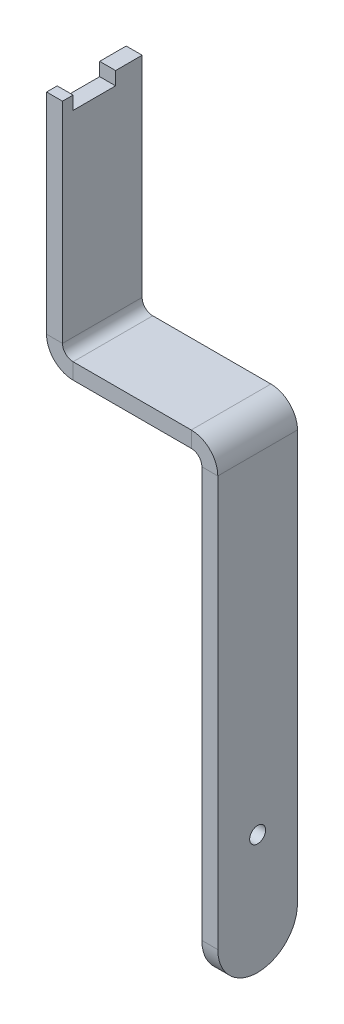
from build123d import *

# Parameters (mm, degrees)
BOSS_EXTRUDE2_DEPTH        = 3
SKETCH5_R                  = 1.5
CUT_EXTRUDE3_DEPTH         = 3
SKETCHED_START             = 72.251106428
SKETCHED_BEND2_OUTLINE_W   = 3
SKETCHED_BEND2_OUTLINE_H   = 15
SKETCHED_BEND2_DEPTH       = 85.748893572
SKETCHED_START_2           = 69.251106428
SKETCHED_BEND2_2_OUTLINE_R = 1.5
SKETCHED_BEND2_2_DEPTH     = 2.5137
SKETCHED_START_3           = 67.251106428
SKETCHED_BEND2_3_OUTLINE_R = 1.5
SKETCHED_BEND2_3_DEPTH     = 5
SKETCHED_START_4           = -107
SKETCHED_BEND2_4_DEPTH     = 17
SKETCHED_START_5           = -105.530592626
SKETCHED_BEND3_DEPTH       = 15
SKETCHED_BEND3_2_DEPTH     = 15
SKETCH26_W                 = 8
SKETCH26_H                 = 2.5
CUT_EXTRUDE8_DEPTH         = 10


with BuildPart() as part:
    # Sketch1 → Boss-Extrude2 (new body)
    with BuildSketch(Plane(origin=(0, 0, 0), x_dir=(1, 0, 0), z_dir=(0, 1, 0))):
        with BuildLine():
            Line((150, 105.530592626), (0, 105.530592626))
            Line((0, 105.530592626), (0, 90.530592626))
            Line((0, 90.530592626), (103.25004789, 90.530592626))
            Line((103.25004789, 90.530592626), (150, 90.530592626))
            ThreePointArc((150, 90.530592626), (157.5, 98.030592626), (150, 105.530592626))
        make_face()
    extrude(amount=BOSS_EXTRUDE2_DEPTH)

    # Sketch5 → Cut-Extrude3 (cut)
    with BuildSketch(Plane(origin=(0, 3, 0), x_dir=(1, 0, 0), z_dir=(0, 1, 0))):
        with Locations(Location((135, 98.030592626, 0), (0, 0, 270))):
            Circle(SKETCH5_R)
    extrude(amount=-CUT_EXTRUDE3_DEPTH, mode=Mode.SUBTRACT)

    # Sketched Bend2: read off the stored shape, not the designer's step
    # Sketched Bend2 outline → Sketched Bend2 (cut)
    with BuildSketch(Plane.YZ.offset(SKETCHED_START)):
        with Locations((1.5, -98.030592626)):
            Rectangle(SKETCHED_BEND2_OUTLINE_W, SKETCHED_BEND2_OUTLINE_H)
    extrude(amount=SKETCHED_BEND2_DEPTH, mode=Mode.SUBTRACT)

    # Sketched Bend2 2 outline → Sketched Bend2 2 (add)
    with BuildSketch(Plane.YZ.offset(SKETCHED_START_2)):
        with BuildLine():
            Line((0, -90.530592626), (-79.251106428, -90.530592626))
            ThreePointArc((-79.251106428, -90.530592626), (-86.751106428, -98.030592626), (-79.251106428, -105.530592626))
            Line((-79.251106428, -105.530592626), (0, -105.530592626))
            Line((0, -105.530592626), (0, -90.530592626))
        make_face()
        with Locations((-64.251106428, -98.030592626)):
            Circle(SKETCHED_BEND2_2_OUTLINE_R, mode=Mode.SUBTRACT)
    extrude(amount=SKETCHED_BEND2_2_DEPTH)

    # Sketched Bend2 3 outline → Sketched Bend2 3 (add)
    with BuildSketch(Plane.YZ.offset(SKETCHED_START_3)):
        with BuildLine():
            Line((0, -90.530592626), (-79.251106428, -90.530592626))
            ThreePointArc((-79.251106428, -90.530592626), (-86.751106428, -98.030592626), (-79.251106428, -105.530592626))
            Line((-79.251106428, -105.530592626), (0, -105.530592626))
            Line((0, -105.530592626), (0, -90.530592626))
        make_face()
        with Locations((-64.251106428, -98.030592626)):
            Circle(SKETCHED_BEND2_3_OUTLINE_R, mode=Mode.SUBTRACT)
    extrude(amount=SKETCHED_BEND2_3_DEPTH)

    # Sketched Bend2 4 outline → Sketched Bend2 4 (cut)
    with BuildSketch(Plane.XY.offset(SKETCHED_START_4)):
        with BuildLine():
            Line((69.251106428, -88), (69.251106428, -2))
            ThreePointArc((69.251106428, -2), (68.66531999, -0.585786438), (67.251106428, 0))
            Line((67.251106428, 0), (67.251106428, -88))
            Line((67.251106428, -88), (69.251106428, -88))
        make_face()
        with BuildLine():
            Line((72.251106428, -2), (72.251106424, -88))
            Line((72.251106424, -88), (74, -88))
            Line((74, -88), (74, 4))
            Line((74, 4), (66, 4))
            Line((66, 4), (66, 3))
            Line((66, 3), (67.251106428, 3))
            ThreePointArc((67.251106428, 3), (70.786640334, 1.535533906), (72.251106428, -2))
        make_face()
    extrude(amount=SKETCHED_BEND2_4_DEPTH, mode=Mode.SUBTRACT)

    # Sketched Bend3: read off the stored shape, not the designer's step
    # Sketched Bend3 outline → Sketched Bend3 (cut)
    with BuildSketch(Plane.XY.offset(SKETCHED_START_5)):
        with BuildLine():
            ThreePointArc((45, 0), (42.261387212, 0.816699867), (40.417424305, 3))
            Line((40.417424305, 3), (0, 3))
            Line((0, 3), (0, 0))
            Line((0, 0), (45, 0))
        make_face()
    extrude(amount=SKETCHED_BEND3_DEPTH, mode=Mode.SUBTRACT)

    # Sketched Bend3 2 outline → Sketched Bend3 2 (add)
    with BuildSketch(Plane.XY.offset(SKETCHED_START_5)):
        with BuildLine():
            ThreePointArc((45, 3), (43.585786438, 3.585786438), (43, 5))
            Line((43, 5), (43, 44.502212856))
            Line((43, 44.502212856), (40, 44.502212856))
            Line((40, 44.502212856), (40, 5))
            ThreePointArc((40, 5), (40.105468435, 3.978451782), (40.417424305, 3))
            Line((40.417424305, 3), (45, 3))
        make_face()
    extrude(amount=SKETCHED_BEND3_2_DEPTH)

    # Sketch26 → Cut-Extrude8 (cut)
    with BuildSketch(Plane(origin=(43, 0, 0), x_dir=(0, 0, -1), z_dir=(1, 0, 0))):
        with Locations((96.530592626, 43.252212856)):
            Rectangle(SKETCH26_W, SKETCH26_H)
    extrude(amount=-CUT_EXTRUDE8_DEPTH, mode=Mode.SUBTRACT)


solid = part.part
